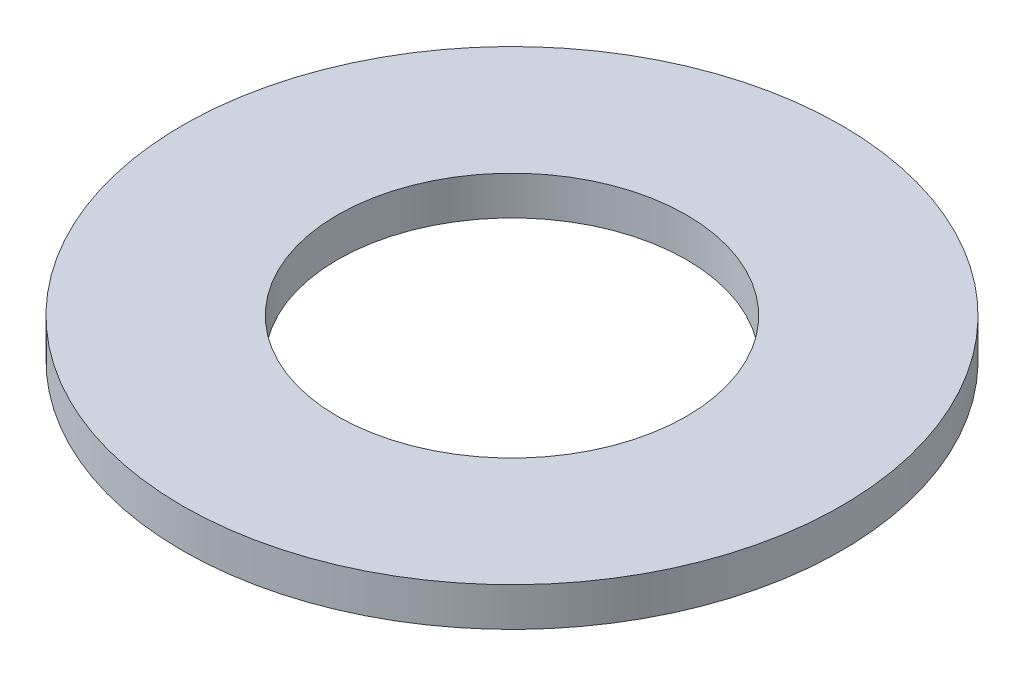
from build123d import *

# Parameters (mm, degrees)
SKETCH1_R           = 85
BOSS_EXTRUDE1_DEPTH = 10
SKETCH2_R           = 45
CUT_EXTRUDE1_DEPTH  = 121.623380818


with BuildPart() as part:
    # Sketch1 → Boss-Extrude1 (new body)
    with BuildSketch(Plane(origin=(0, 0, 0), x_dir=(1, 0, 0), z_dir=(0, 1, 0))):
        Circle(SKETCH1_R)
    extrude(amount=BOSS_EXTRUDE1_DEPTH)

    # Sketch2 → Cut-Extrude1 (cut, through all)
    with BuildSketch(Plane(origin=(0, 0, 0), x_dir=(1, 0, 0), z_dir=(0, 1, 0))):
        Circle(SKETCH2_R)
    extrude(amount=CUT_EXTRUDE1_DEPTH, mode=Mode.SUBTRACT)


solid = part.part
